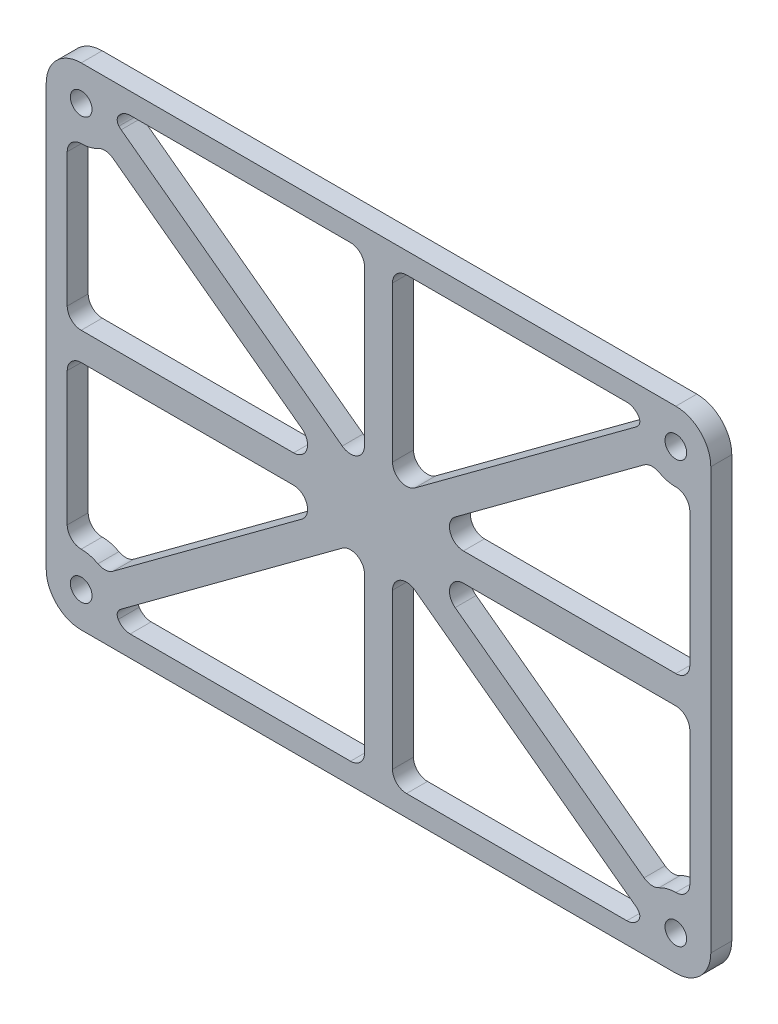
from build123d import *

# Parameters (mm, degrees)
SKETCH_1_R      = 5
SKETCH_1_R_2    = 1.55
EXTRUDE_1_DEPTH = 3
FILLET_1_R      = 2
FILLET_2_R      = 1


with BuildPart() as part:
    # 草图1 → 凸台-拉伸1 (new body)
    # profile 1 of 5: a face of its own
    with BuildSketch(Plane.XY):
        with BuildLine():
            Line((-42.5, -35.1), (42.5, -35.1))
            ThreePointArc((42.5, -35.1), (39.761387212, -34.283300133), (37.917424305, -32.1))
            Line((37.917424305, -32.1), (2, -32.1))
            Line((2, -32.1), (2, -3.964694458))
            Line((2, -3.964694458), (37.500961204, -30.198036316))
            ThreePointArc((37.500961204, -30.198036316), (37.902514018, -28.134517198), (39.116783888, -26.418444794))
            Line((39.116783888, -26.418444794), (6.071879965, -2))
            Line((6.071879965, -2), (44.5, -2))
            Line((44.5, -2), (44.5, -25.517424305))
            ThreePointArc((44.5, -25.517424305), (46.683300133, -27.361387212), (47.5, -30.1))
            Line((47.5, -30.1), (47.5, 30.1))
            ThreePointArc((47.5, 30.1), (46.683300133, 27.361387212), (44.5, 25.517424305))
            Line((44.5, 25.517424305), (44.5, 2))
            Line((44.5, 2), (6.071879965, 2))
            Line((6.071879965, 2), (39.116783888, 26.418444794))
            ThreePointArc((39.116783888, 26.418444794), (37.902514018, 28.134517198), (37.500961204, 30.198036316))
            Line((37.500961204, 30.198036316), (2, 3.964694458))
            Line((2, 3.964694458), (2, 32.1))
            Line((2, 32.1), (37.917424305, 32.1))
            ThreePointArc((37.917424305, 32.1), (39.761387212, 34.283300133), (42.5, 35.1))
            Line((42.5, 35.1), (-42.5, 35.1))
            ThreePointArc((-42.5, 35.1), (-39.761387212, 34.283300133), (-37.917424305, 32.1))
            Line((-37.917424305, 32.1), (-2, 32.1))
            Line((-2, 32.1), (-2, 3.964694458))
            Line((-2, 3.964694458), (-37.500961204, 30.198036316))
            ThreePointArc((-37.500961204, 30.198036316), (-37.500240307, 30.149020514), (-37.5, 30.1))
            ThreePointArc((-37.5, 30.1), (-37.922004775, 28.089537437), (-39.116783888, 26.418444794))
            Line((-39.116783888, 26.418444794), (-6.071879965, 2))
            Line((-6.071879965, 2), (-44.5, 2))
            Line((-44.5, 2), (-44.5, 25.517424305))
            ThreePointArc((-44.5, 25.517424305), (-46.683300133, 27.361387212), (-47.5, 30.1))
            Line((-47.5, 30.1), (-47.5, -30.1))
            ThreePointArc((-47.5, -30.1), (-46.683300133, -27.361387212), (-44.5, -25.517424305))
            Line((-44.5, -25.517424305), (-44.5, -2))
            Line((-44.5, -2), (-6.071879965, -2))
            Line((-6.071879965, -2), (-39.116783888, -26.418444794))
            ThreePointArc((-39.116783888, -26.418444794), (-37.922004775, -28.089537437), (-37.5, -30.1))
            ThreePointArc((-37.5, -30.1), (-37.500240307, -30.149020514), (-37.500961204, -30.198036316))
            Line((-37.500961204, -30.198036316), (-2, -3.964694458))
            Line((-2, -3.964694458), (-2, -32.1))
            Line((-2, -32.1), (-37.917424305, -32.1))
            ThreePointArc((-37.917424305, -32.1), (-39.761387212, -34.283300133), (-42.5, -35.1))
        make_face()
    # profile 2 of 5: a face of its own
    with BuildSketch(Plane.XY):
        with Locations((-42.5, 30.1)):
            Circle(SKETCH_1_R)
        with Locations((-42.5, 30.1)):
            Circle(SKETCH_1_R_2, mode=Mode.SUBTRACT)
    # profile 3 of 5: a face of its own
    with BuildSketch(Plane.XY):
        with Locations((42.5, 30.1)):
            Circle(SKETCH_1_R)
        with Locations((42.5, 30.1)):
            Circle(SKETCH_1_R_2, mode=Mode.SUBTRACT)
    # profile 4 of 5: a face of its own
    with BuildSketch(Plane.XY):
        with Locations((42.5, -30.1)):
            Circle(SKETCH_1_R)
        with Locations((42.5, -30.1)):
            Circle(SKETCH_1_R_2, mode=Mode.SUBTRACT)
    # profile 5 of 5: a face of its own
    with BuildSketch(Plane.XY):
        with Locations((-42.5, -30.1)):
            Circle(SKETCH_1_R)
        with Locations((-42.5, -30.1)):
            Circle(SKETCH_1_R_2, mode=Mode.SUBTRACT)
    extrude(amount=EXTRUDE_1_DEPTH)

    # 圆角1
    # the kernel refuses this fillet: 2 mm, written as the material it adds along each edge
    with BuildSketch(Plane(origin=(39.116783888, 26.418444794, 0), x_dir=(-0.8042465112804378, -0.5942958430724927, 0), z_dir=(0, 0, 1)), Plane(origin=(-39.116783888, -26.418444794, 0), x_dir=(0.8042465112804382, 0.5942958430724918, 0), z_dir=(0, 0, 1))) as fillet_1_piece_1:
        with BuildLine():
            CenterArc((1.439043849, 2), FILLET_1_R, 204.927038376, 65.072961624)
            ThreePointArc((-0.374646596, 1.157072383), (-0.152011037, 0.589969891), (0, 0))
            Line((0, 0), (1.439043849, 0))
        make_face()
    extrude(amount=3)
    with BuildSketch(Plane(origin=(6.071879965, 2, 0), x_dir=(1, 0, 0), z_dir=(0, 0, 1)), Plane(origin=(6.071879965, -2, 0), x_dir=(0.804246511280438, -0.5942958430724921, 0), z_dir=(0, 0, 1)), Plane(origin=(-6.071879965, -2, 0), x_dir=(-1, 0, 0), z_dir=(0, 0, 1)), Plane(origin=(-6.071879965, 2, 0), x_dir=(-0.8042465112804379, 0.5942958430724924, 0), z_dir=(0, 0, 1))) as fillet_1_piece_2:
        with BuildLine():
            CenterArc((FILLET_1_R * 3.03593998227, FILLET_1_R), FILLET_1_R, 126.462450613, 143.537549387)
            Line((FILLET_1_R * 2.4416441392, FILLET_1_R * 1.80424651128), (0, 0))
            Line((0, 0), (FILLET_1_R * 3.03593998227, 0))
        make_face()
    extrude(amount=3)
    with BuildSketch(Plane(origin=(44.5, 2, 0), x_dir=(0, 1, 0), z_dir=(0, 0, 1)), Plane(origin=(44.5, -2, 0), x_dir=(-1, 0, 0), z_dir=(0, 0, 1)), Plane(origin=(2, -32.1, 0), x_dir=(1, 0, 0), z_dir=(0, 0, 1)), Plane(origin=(-2, -32.1, 0), x_dir=(0, 1, 0), z_dir=(0, 0, 1)), Plane(origin=(-44.5, -2, 0), x_dir=(0, -1, 0), z_dir=(0, 0, 1)), Plane(origin=(-44.5, 2, 0), x_dir=(1, 0, 0), z_dir=(0, 0, 1)), Plane(origin=(-2, 32.1, 0), x_dir=(-1, 0, 0), z_dir=(0, 0, 1)), Plane(origin=(2, 32.1, 0), x_dir=(0, -1, 0), z_dir=(0, 0, 1))) as fillet_1_piece_3:
        with BuildLine():
            CenterArc((FILLET_1_R, FILLET_1_R), FILLET_1_R, 180, 90)
            Line((0, FILLET_1_R), (0, 0))
            Line((0, 0), (FILLET_1_R, 0))
        make_face()
    extrude(amount=3)
    with BuildSketch(Plane(origin=(44.5, 25.517424305, 0), x_dir=(0, -1, 0), z_dir=(0, 0, 1)), Plane(origin=(37.917424305, -32.1, 0), x_dir=(-1, 0, 0), z_dir=(0, 0, 1)), Plane(origin=(-44.5, -25.517424305, 0), x_dir=(0, 1, 0), z_dir=(0, 0, 1)), Plane(origin=(-37.917424305, 32.1, 0), x_dir=(1, 0, 0), z_dir=(0, 0, 1))) as fillet_1_piece_4:
        with BuildLine():
            CenterArc((2.417424305, -2), FILLET_1_R, 90, 90)
            ThreePointArc((0.417424305, -2), (0.31195587, -0.978451782), (0, 0))
            Line((0, 0), (2.417424305, 0))
        make_face()
    extrude(amount=3)
    with BuildSketch(Plane(origin=(44.5, -25.517424305, 0), x_dir=(0, 1, 0), z_dir=(0, 0, 1)), Plane(origin=(-37.917424305, -32.1, 0), x_dir=(1, 0, 0), z_dir=(0, 0, 1)), Plane(origin=(-44.5, 25.517424305, 0), x_dir=(0, -1, 0), z_dir=(0, 0, 1)), Plane(origin=(37.917424305, 32.1, 0), x_dir=(-1, 0, 0), z_dir=(0, 0, 1))) as fillet_1_piece_5:
        with BuildLine():
            CenterArc((2.417424305, 2), FILLET_1_R, 180, 90)
            ThreePointArc((0.417424305, 2), (0.31195587, 0.978451782), (0, 0))
            Line((0, 0), (2.417424305, 0))
        make_face()
    extrude(amount=3)
    with BuildSketch(Plane(origin=(39.116783888, -26.418444794, 0), x_dir=(-0.8042465112804377, 0.5942958430724928, 0), z_dir=(0, 0, 1)), Plane(origin=(-39.116783888, 26.418444794, 0), x_dir=(0.8042465112804396, -0.5942958430724902, 0), z_dir=(0, 0, 1))) as fillet_1_piece_6:
        with BuildLine():
            CenterArc((1.439043849, -2), FILLET_1_R, 90, 65.072961624)
            ThreePointArc((-0.374646596, -1.157072383), (-0.152011037, -0.589969891), (0, 0))
            Line((0, 0), (1.439043849, 0))
        make_face()
    extrude(amount=3)
    with BuildSketch(Plane(origin=(2, -3.964694458, 0), x_dir=(0, -1, 0), z_dir=(0, 0, 1)), Plane(origin=(-2, -3.964694458, 0), x_dir=(-0.8042465112804379, -0.5942958430724925, 0), z_dir=(0, 0, 1)), Plane(origin=(-2, 3.964694458, 0), x_dir=(0, 1, 0), z_dir=(0, 0, 1)), Plane(origin=(2, 3.964694458, 0), x_dir=(0.804246511280438, 0.5942958430724923, 0), z_dir=(0, 0, 1))) as fillet_1_piece_7:
        with BuildLine():
            CenterArc((FILLET_1_R * 1.982347229, FILLET_1_R), FILLET_1_R, 143.537549387, 126.462450613)
            Line((FILLET_1_R * 1.17810071772, FILLET_1_R * 1.59429584307), (0, 0))
            Line((0, 0), (FILLET_1_R * 1.982347229, 0))
        make_face()
    extrude(amount=3)
    with BuildSketch(Plane(origin=(37.500961204, -30.198036316, 0), x_dir=(-0.8042465112804396, 0.5942958430724902, 0), z_dir=(0, 0, 1)), Plane(origin=(-37.500961204, 30.198036316, 0), x_dir=(0.8042465112804383, -0.5942958430724916, 0), z_dir=(0, 0, 1))) as fillet_1_piece_8:
        with BuildLine():
            CenterArc((0.885482013, 2), FILLET_1_R, 226.169636842, 43.830363158)
            ThreePointArc((-0.499569115, 0.557213331), (-0.239344892, 0.287966338), (0, 0))
            Line((0, 0), (0.885482013, 0))
        make_face()
    extrude(amount=3)
    with BuildSketch(Plane(origin=(-37.500961204, -30.198036316, 0), x_dir=(0.8042465112804397, 0.59429584307249, 0), z_dir=(0, 0, 1)), Plane(origin=(37.500961204, 30.198036316, 0), x_dir=(-0.8042465112804407, -0.5942958430724886, 0), z_dir=(0, 0, 1))) as fillet_1_piece_9:
        with BuildLine():
            CenterArc((0.885482013, -2), FILLET_1_R, 90, 43.830363158)
            ThreePointArc((-0.499569115, -0.557213331), (-0.239344892, -0.287966338), (0, 0))
            Line((0, 0), (0.885482013, 0))
        make_face()
    extrude(amount=3)

    # 圆角2
    fillet_2_edges = [part.edges().sort_by_distance(p)[0] for p in [
        (37.453554234, -30.528515876, 1.5),
        (-37.453554234, -30.528515876, 1.5),
        (-37.453554234, 30.528515876, 1.5),
        (37.453554234, 30.528515876, 1.5),
    ]]
    fillet(fillet_2_edges, radius=FILLET_2_R)


solid = part.part
